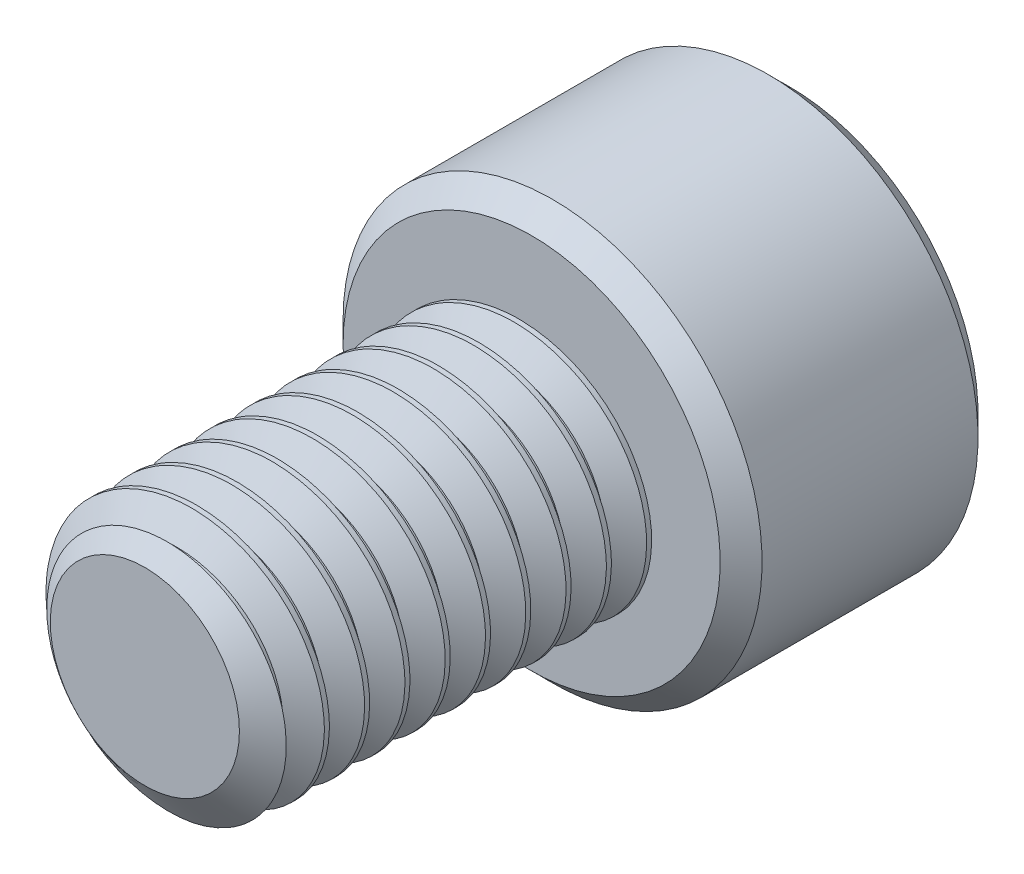
from build123d import *

# Parameters (mm, degrees)
SKETCH1_R          = 4
EXTRUDE1_DEPTH     = 12
CUT_SWEEP1_PITCH   = 1.25
SKETCH6_R          = 6.5
EXTRUDE2_DEPTH     = 8
CUT_EXTRUDE1_DEPTH = 4.5
CHAMFER1_SIZE      = 0.65


with BuildPart() as part:
    # Sketch1 → Extrude1 (new body)
    with BuildSketch(Plane.XY):
        Circle(SKETCH1_R)
    extrude(amount=-EXTRUDE1_DEPTH)

    # Cut-Sweep1: the profile of Sketch3 profile screwed along a right-hand helix of 10.6 turns, 6 arcs to a turn; built about Z, then put on its axis
    cut_sweep1_z = Axis((0, 0, 0), (0, 0, 1))
    cut_sweep1_corners = [(4.0003, 0, -1.093923205), (3.188101184, 0, -0.625), (3.188101184, 0, -0.46875), (4.0003, 0, 0.000173205)]
    with BuildLine(mode=Mode.PRIVATE) as cut_sweep1_profile:
        Line(cut_sweep1_corners[0], cut_sweep1_corners[1])
        Line(cut_sweep1_corners[1], cut_sweep1_corners[2])
        Line(cut_sweep1_corners[2], cut_sweep1_corners[3])
        Line(cut_sweep1_corners[3], cut_sweep1_corners[0])
    cut_sweep1_cap = Face(cut_sweep1_profile.wire())
    cut_sweep1_turn_angles = [0, 30, 60, 90, 120, 150, 180, 210, 240, 270, 300, 330, 360]
    cut_sweep1_turn_weights = [1, 0.8660254037844387, 1, 0.8660254037844387, 1, 0.8660254037844387, 1, 0.8660254037844387, 1, 0.8660254037844387, 1, 0.8660254037844387, 1]
    cut_sweep1_turn_rails = [Edge.make_bspline([Vector(p[0], p[1], 0).rotate(cut_sweep1_z, cut_sweep1_turn_angles[k]) / cut_sweep1_turn_weights[k] + Vector(0, 0, p[2] + CUT_SWEEP1_PITCH * cut_sweep1_turn_angles[k] / 360) for k in range(13)], [0, 0, 0, 1, 1, 2, 2, 3, 3, 4, 4, 5, 5, 6, 6, 6], 2, cut_sweep1_turn_weights) for p in cut_sweep1_corners]
    cut_sweep1_turn_sides = [Face.make_surface_from_curves(cut_sweep1_turn_rails[p[0]], cut_sweep1_turn_rails[p[1]]) for p in [(0, 1), (1, 2), (2, 3), (3, 0)]]
    cut_sweep1_last_angles = [3600, 3630, 3660, 3690, 3720, 3750, 3780, 3798, 3816]
    cut_sweep1_last_weights = [1, 0.8660254037844387, 1, 0.8660254037844387, 1, 0.8660254037844387, 1, 0.9510565162950726, 1]
    cut_sweep1_last_rails = [Edge.make_bspline([Vector(p[0], p[1], 0).rotate(cut_sweep1_z, cut_sweep1_last_angles[k]) / cut_sweep1_last_weights[k] + Vector(0, 0, p[2] + CUT_SWEEP1_PITCH * cut_sweep1_last_angles[k] / 360) for k in range(9)], [0, 0, 0, 1, 1, 2, 2, 3, 3, 4, 4, 4], 2, cut_sweep1_last_weights) for p in cut_sweep1_corners]
    cut_sweep1_last_sides = [Face.make_surface_from_curves(cut_sweep1_last_rails[p[0]], cut_sweep1_last_rails[p[1]]) for p in [(0, 1), (1, 2), (2, 3), (3, 0)]]
    cut_sweep1 = Plane(origin=(0, 0, 0), x_dir=(0, 1, 0), z_dir=(0, 0, -1)) * Solid(Shell([*[p.moved(Location((0, 0, CUT_SWEEP1_PITCH * i))) for i in range(10) for p in cut_sweep1_turn_sides], *cut_sweep1_last_sides, cut_sweep1_cap, cut_sweep1_cap.rotate(cut_sweep1_z, 3816).moved(Location((0, 0, CUT_SWEEP1_PITCH * 3816 / 360)))]))
    add(cut_sweep1, mode=Mode.SUBTRACT)

    # Sketch4 → Cut-Revolve1 (revolve, cut)
    with BuildSketch(Plane(origin=(0, 0, 0), x_dir=(0, 0, -1), z_dir=(1, 0, 0)), mode=Mode.PRIVATE) as cut_revolve1_sk:
        Polygon((0.746350386, 4), (0, 2.934101184), (0, 4), align=None)
    revolve(cut_revolve1_sk.sketch.rotate(Axis((0, 0, 0), (0, 0, -1)), 230.713364492), axis=Axis((0, 0, 0), (0, 0, -1)), mode=Mode.SUBTRACT)

    # Sketch6 → Extrude2 (add)
    with BuildSketch(Plane(origin=(0, 0, -12), x_dir=(-1, 0, 0), z_dir=(0, 0, -1))):
        Circle(SKETCH6_R)
    extrude(amount=EXTRUDE2_DEPTH)

    # Sketch7 → Cut-Extrude1 (cut)
    with BuildSketch(Plane(origin=(0, 0, -20), x_dir=(-1, 0, 0), z_dir=(0, 0, -1))):
        Polygon((0, 3.464101615), (-3, 1.732050808), (-3, -1.732050808), (0, -3.464101615), (3, -1.732050808), (3, 1.732050808), align=None)
    extrude(amount=-CUT_EXTRUDE1_DEPTH, mode=Mode.SUBTRACT)

    # Cut-Extrude2 cone 1 section (through the dimple's axis) → Cut-Extrude2 (revolve, cut)
    with BuildSketch(Plane(origin=(0, 0, -20), x_dir=(0, 1, 0), z_dir=(1, 0, 0))):
        Polygon((0, 0), (3.464101615, 0), (0, 3.464101615), align=None)
    revolve(axis=Axis((0, 0, -20), (0, 0, 1)), mode=Mode.SUBTRACT)

    # Chamfer1
    chamfer1_edges = [part.edges().sort_by_distance(p)[0] for p in [
        (6.5, 0, -12),
        (6.5, 0, -20),
    ]]
    chamfer(chamfer1_edges, length=CHAMFER1_SIZE)


solid = part.part
